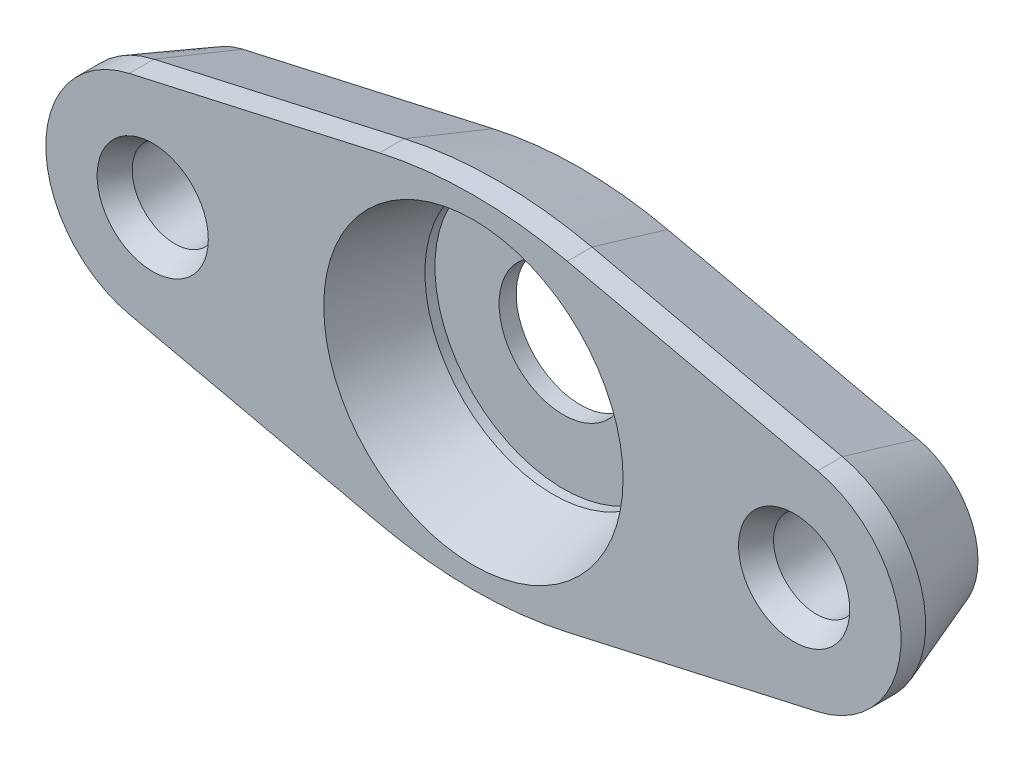
from build123d import *

# Parameters (mm, degrees)
SKETCH1_R           = 1
BOSS_EXTRUDE1_DEPTH = 2.5
SKETCH2_R           = 3
CUT_EXTRUDE1_DEPTH  = 2.1
CHAMFER1_SIZE       = 0.7
CHAMFER1_SIZE2      = 1.923234194
CHAMFER2_SIZE       = 0.5
CHAMFER2_SIZE2      = 1.866025404
CHAMFER3_SIZE       = 0.3
CHAMFER3_SIZE2      = 0.519615242
SKETCH3_R           = 1.5
CUT_EXTRUDE2_DEPTH  = 10


with BuildPart() as part:
    # Sketch1 → Boss-Extrude1 (new body)
    with BuildSketch(Plane.XY):
        with BuildLine():
            Line((-8.048780488, 2.43902439), (-2.195121951, 3.756097561))
            ThreePointArc((-2.195121951, 3.756097561), (0, 4), (2.195121951, 3.756097561))
            Line((2.195121951, 3.756097561), (8.048780488, 2.43902439))
            ThreePointArc((8.048780488, 2.43902439), (10, 0), (8.048780488, -2.43902439))
            Line((8.048780488, -2.43902439), (2.195121951, -3.756097561))
            ThreePointArc((2.195121951, -3.756097561), (0, -4), (-2.195121951, -3.756097561))
            Line((-2.195121951, -3.756097561), (-8.048780488, -2.43902439))
            ThreePointArc((-8.048780488, -2.43902439), (-10, 0), (-8.048780488, 2.43902439))
        make_face()
        with Locations((7.5, 0)):
            Circle(SKETCH1_R, mode=Mode.SUBTRACT)
        with Locations((-7.5, 0)):
            Circle(SKETCH1_R, mode=Mode.SUBTRACT)
    extrude(amount=BOSS_EXTRUDE1_DEPTH)

    # Sketch2 → Cut-Extrude1 (cut)
    with BuildSketch(Plane.XY.offset(2.5)):
        Circle(SKETCH2_R)
    extrude(amount=-CUT_EXTRUDE1_DEPTH, mode=Mode.SUBTRACT)

    # Chamfer1
    chamfer1_edges = [part.edges().sort_by_distance(p)[0] for p in [
        (-5.12195122, 3.097560976, 0),
        (-10, 0, 0),
        (0, 4, 0),
        (-5.12195122, -3.097560976, 0),
        (5.12195122, 3.097560976, 0),
        (0, -4, 0),
        (10, 0, 0),
        (5.12195122, -3.097560976, 0),
    ]]
    chamfer1_side = [part.faces().sort_by_distance(p)[0] for p in [
        (0, 0, 0),
    ]]
    chamfer(chamfer1_edges, length=CHAMFER1_SIZE, length2=CHAMFER1_SIZE2, reference=chamfer1_side[0])

    # Chamfer2
    chamfer2_edges = [part.edges().sort_by_distance(p)[0] for p in [
        (-3, 0, 2.5),
    ]]
    chamfer2_side = [part.faces().sort_by_distance(p)[0] for p in [
        (-5.074666846, 2.887408203, 2.5),
    ]]
    chamfer(chamfer2_edges, length=CHAMFER2_SIZE, length2=CHAMFER2_SIZE2, reference=chamfer2_side[0])

    # Chamfer3
    chamfer3_edges = [part.edges().sort_by_distance(p)[0] for p in [
        (6.5, 0, 2.5),
        (-8.5, 0, 2.5),
    ]]
    chamfer3_side = [part.faces().sort_by_distance(p)[0] for p in [
        (-3.715406592, 0, 2.5),
    ]]
    chamfer(chamfer3_edges, length=CHAMFER3_SIZE, length2=CHAMFER3_SIZE2, reference=chamfer3_side[0])

    # Sketch3 → Cut-Extrude2 (cut)
    with BuildSketch(Plane.XY.offset(0.4)):
        Circle(SKETCH3_R)
    extrude(amount=-CUT_EXTRUDE2_DEPTH, mode=Mode.SUBTRACT)


solid = part.part
